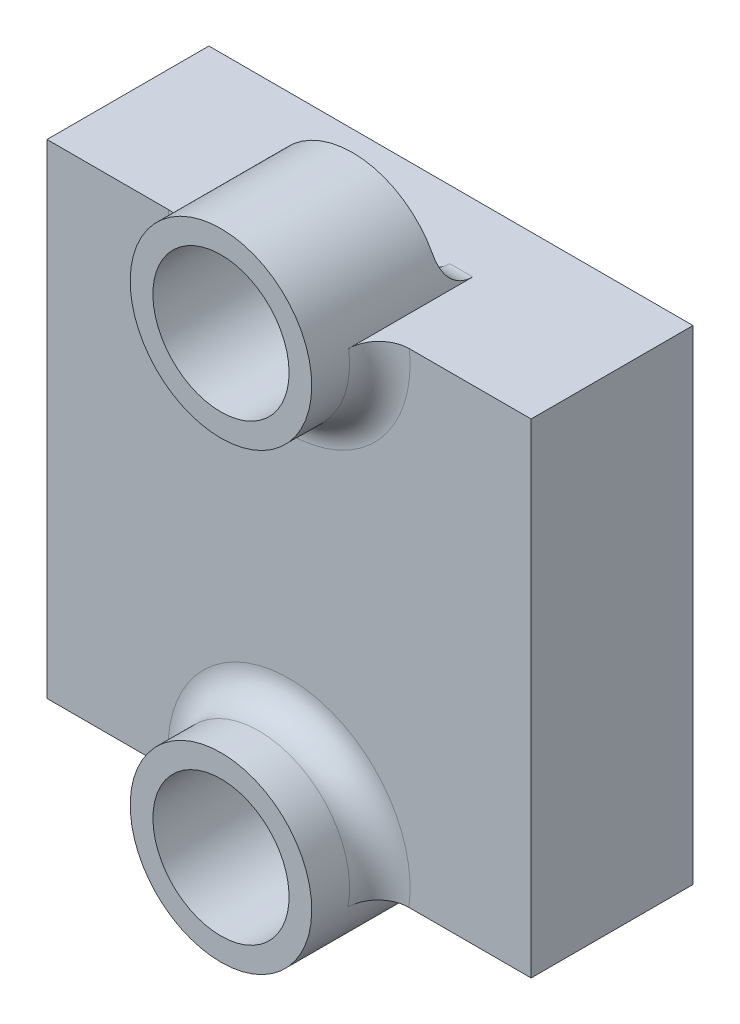
from build123d import *

# Parameters (mm, degrees)
SKETCH5_W           = 16
SKETCH5_H           = 16
SKETCH5_R           = 2.55
BOSS_EXTRUDE1_DEPTH = 1.75
BOSS_EXTRUDE2_START = 1.75
SKETCH5_4_W         = 16
SKETCH5_4_H         = 16
BOSS_EXTRUDE2_DEPTH = 1.5
BOSS_EXTRUDE3_START = 3.25
SKETCH5_5_R         = 2.25
BOSS_EXTRUDE3_DEPTH = 2.1
BOSS_EXTRUDE4_START = 5.35
SKETCH5_6_R         = 3
SKETCH5_6_R_2       = 2.25
BOSS_EXTRUDE4_DEPTH = 2.25
FILLET1_R           = 1


with BuildPart() as part:
    # Sketch5 → Boss-Extrude1 (new body)
    with BuildSketch(Plane.XY.offset(9.6)):
        with Locations((-64, -16)):
            Rectangle(SKETCH5_W, SKETCH5_H)
        with Locations(Location((-68, -20, 0), (0, 0, 270))):
            Circle(SKETCH5_R, mode=Mode.SUBTRACT)
        with Locations(Location((-60, -20, 0), (0, 0, 270))):
            Circle(SKETCH5_R, mode=Mode.SUBTRACT)
        with Locations(Location((-68, -12, 0), (0, 0, 270))):
            Circle(SKETCH5_R, mode=Mode.SUBTRACT)
        with Locations(Location((-60, -12, 0), (0, 0, 270))):
            Circle(SKETCH5_R, mode=Mode.SUBTRACT)
    extrude(amount=BOSS_EXTRUDE1_DEPTH)

    # Sketch5<4> → Boss-Extrude2 (add)
    with BuildSketch(Plane.XY.offset(9.6).offset(BOSS_EXTRUDE2_START)):
        with Locations((-64, -16)):
            Rectangle(SKETCH5_4_W, SKETCH5_4_H)
    extrude(amount=BOSS_EXTRUDE2_DEPTH)

    # Sketch5<5> → Boss-Extrude3 (add)
    with BuildSketch(Plane.XY.offset(9.6).offset(BOSS_EXTRUDE3_START)):
        with BuildLine():
            Line((-66.969743255, -8), (-72, -8))
            Line((-72, -8), (-72, -24))
            Line((-72, -24), (-66.94438024, -24))
            ThreePointArc((-66.94438024, -24), (-64, -26.425), (-61.05561976, -24))
            Line((-61.05561976, -24), (-56, -24))
            Line((-56, -24), (-56, -8))
            Line((-56, -8), (-61.030256745, -8))
            ThreePointArc((-61.030256745, -8), (-64, -5.425), (-66.969743255, -8))
        make_face()
        with Locations(Location((-64, -23.425, 0), (0, 0, 194.806506912))):
            Circle(SKETCH5_5_R, mode=Mode.SUBTRACT)
        with Locations(Location((-64, -8.425, 0), (0, 0, 169.11205187))):
            Circle(SKETCH5_5_R, mode=Mode.SUBTRACT)
    extrude(amount=BOSS_EXTRUDE3_DEPTH)

    # Sketch5<6> → Boss-Extrude4 (add)
    # profile 1 of 2: a face of its own
    with BuildSketch(Plane.XY.offset(9.6).offset(BOSS_EXTRUDE4_START)):
        with Locations(Location((-64, -8.425, 0), (0, 0, 171.855699446))):
            Circle(SKETCH5_6_R)
        with Locations(Location((-64, -8.425, 0), (0, 0, 169.11205187))):
            Circle(SKETCH5_6_R_2, mode=Mode.SUBTRACT)
    # profile 2 of 2: a face of its own
    with BuildSketch(Plane.XY.offset(9.6).offset(BOSS_EXTRUDE4_START)):
        with Locations(Location((-64, -23.425, 0), (0, 0, 191.050064959))):
            Circle(SKETCH5_6_R)
        with Locations(Location((-64, -23.425, 0), (0, 0, 194.806506912))):
            Circle(SKETCH5_6_R_2, mode=Mode.SUBTRACT)
    extrude(amount=BOSS_EXTRUDE4_DEPTH)

    # Fillet1
    # the kernel refuses this fillet: 1 mm, written as the material it adds along each edge
    with BuildSketch(Plane(origin=(-64, -8.425, 14.95), x_dir=(-0.5594516759376825, 0.8288629695495621, 0), z_dir=(0.8288629695495621, 0.5594516759376825, 0))) as fillet1_piece_1_section:
        with BuildLine():
            CenterArc((3 + FILLET1_R, FILLET1_R), FILLET1_R, 180, 90)
            Line((3, FILLET1_R), (3, 0))
            Line((3, 0), (3 + FILLET1_R, 0))
        make_face()
    fillet1_piece_1 = revolve(axis=Axis((-64, -8.425, 14.95), (0, 0, 1)), revolution_arc=291.964228084, mode=Mode.PRIVATE)
    fillet1_piece_1 = split(fillet1_piece_1, bisect_by=Plane(origin=(-64, -8, 15.233484072), z_dir=(0, -1, 0)), keep=Keep.TOP, mode=Mode.PRIVATE)
    add(fillet1_piece_1)
    with BuildSketch(Plane(origin=(-64, -23.425, 14.95), x_dir=(0.516632343586421, -0.8562073472941015, 0), z_dir=(-0.8562073472941015, -0.516632343586421, 0))) as fillet1_piece_2_section:
        with BuildLine():
            CenterArc((3 + FILLET1_R, FILLET1_R), FILLET1_R, 180, 90)
            Line((3 + FILLET1_R, 0), (3, 0))
            Line((3, 0), (3, FILLET1_R))
        make_face()
    fillet1_piece_2 = revolve(axis=Axis((-64, -23.425, 14.95), (0, 0, 1)), revolution_arc=297.786748706, mode=Mode.PRIVATE)
    fillet1_piece_2 = split(fillet1_piece_2, bisect_by=Plane(origin=(-64, -24, 15.23339809), z_dir=(0, 1, 0)), keep=Keep.TOP, mode=Mode.PRIVATE)
    add(fillet1_piece_2)
    with BuildSketch(Plane(origin=(-58.55561976, -24, 12.85), x_dir=(0, 0, -1), z_dir=(-1, 0, 0))) as fillet1_piece_3_section:
        with BuildLine():
            CenterArc((FILLET1_R, FILLET1_R), FILLET1_R, 180, 90)
            Line((0, FILLET1_R), (0, 0))
            Line((0, 0), (FILLET1_R, 0))
        make_face()
    fillet1_piece_3 = extrude(amount=5.769092903, mode=Mode.PRIVATE)
    fillet1_piece_3 = fillet1_piece_3 - Plane(origin=(-64, -23.425, 12.629693614), x_dir=(-0.9667943721514972, -0.2555555555572849, 0), z_dir=(0, 0, -1)) * Cylinder(2.25, 16, mode=Mode.PRIVATE)
    fillet1_piece_3 = fillet1_piece_3 & Plane(origin=(-64, -23.425, 12.629693614), x_dir=(-0.9814600801300545, -0.19166666666665624, 0), z_dir=(0, 0, -1)) * Cylinder(3, 16, mode=Mode.PRIVATE)
    add(fillet1_piece_3)
    with BuildSketch(Plane(origin=(-63.675287337, -24, 12.85), x_dir=(0, 0, -1), z_dir=(-1, 0, 0))) as fillet1_piece_4_section:
        with BuildLine():
            CenterArc((FILLET1_R, FILLET1_R), FILLET1_R, 180, 90)
            Line((0, FILLET1_R), (0, 0))
            Line((0, 0), (FILLET1_R, 0))
        make_face()
    fillet1_piece_4 = extrude(amount=5.769092903, mode=Mode.PRIVATE)
    fillet1_piece_4 = fillet1_piece_4 - Plane(origin=(-64, -23.425, 12.629693822), x_dir=(-0.9667943721514972, -0.2555555555572849, 0), z_dir=(0, 0, -1)) * Cylinder(2.25, 16, mode=Mode.PRIVATE)
    fillet1_piece_4 = fillet1_piece_4 & Plane(origin=(-64, -23.425, 12.629693822), x_dir=(-0.9814600801300545, -0.19166666666665624, 0), z_dir=(0, 0, -1)) * Cylinder(3, 16, mode=Mode.PRIVATE)
    add(fillet1_piece_4)
    with BuildSketch(Plane(origin=(-64.290503451, -8, 12.85), x_dir=(0, 1, 0), z_dir=(1, 0, 0))) as fillet1_piece_5_section:
        with BuildLine():
            CenterArc((FILLET1_R, -FILLET1_R), FILLET1_R, 90, 90)
            Line((0, -FILLET1_R), (0, 0))
            Line((0, 0), (FILLET1_R, 0))
        make_face()
    fillet1_piece_5 = extrude(amount=5.760246706, mode=Mode.PRIVATE)
    fillet1_piece_5 = fillet1_piece_5 & Plane(origin=(-64, -8.425, 12.629046525), x_dir=(0.9899144182986506, 0.14166666666666652, 0), z_dir=(0, 0, -1)) * Cylinder(3, 16, mode=Mode.PRIVATE)
    fillet1_piece_5 = fillet1_piece_5 - Plane(origin=(-64, -8.425, 12.629046525), x_dir=(-0.9819984662183027, 0.1888888888868298, 0), z_dir=(0, 0, -1)) * Cylinder(2.25, 16, mode=Mode.PRIVATE)
    add(fillet1_piece_5)
    with BuildSketch(Plane(origin=(-69.469743255, -8, 12.85), x_dir=(0, 1, 0), z_dir=(1, 0, 0))) as fillet1_piece_6_section:
        with BuildLine():
            CenterArc((FILLET1_R, -FILLET1_R), FILLET1_R, 90, 90)
            Line((0, -FILLET1_R), (0, 0))
            Line((0, 0), (FILLET1_R, 0))
        make_face()
    fillet1_piece_6 = extrude(amount=5.760246706, mode=Mode.PRIVATE)
    fillet1_piece_6 = fillet1_piece_6 & Plane(origin=(-64, -8.425, 12.629046589), x_dir=(0.9899144182986506, 0.14166666666666652, 0), z_dir=(0, 0, -1)) * Cylinder(3, 16, mode=Mode.PRIVATE)
    fillet1_piece_6 = fillet1_piece_6 - Plane(origin=(-64, -8.425, 12.629046589), x_dir=(-0.9819984662183027, 0.1888888888868298, 0), z_dir=(0, 0, -1)) * Cylinder(2.25, 16, mode=Mode.PRIVATE)
    add(fillet1_piece_6)


solid = part.part
